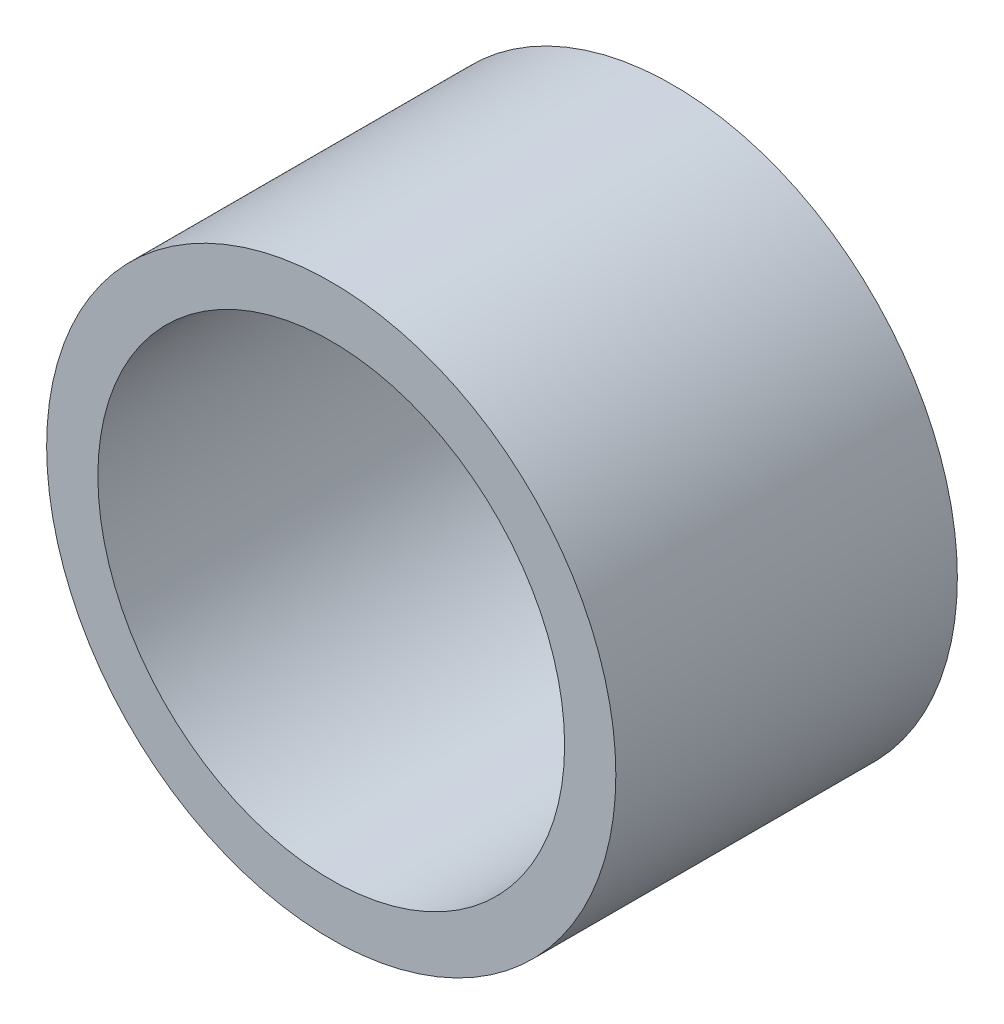
from build123d import *

# Parameters (mm, degrees)
SKETCH1_R           = 5
SKETCH1_R_2         = 4.1
BOSS_EXTRUDE1_DEPTH = 6


with BuildPart() as part:
    # Sketch1 → Boss-Extrude1 (new body)
    with BuildSketch(Plane.XY):
        Circle(SKETCH1_R)
        Circle(SKETCH1_R_2, mode=Mode.SUBTRACT)
    extrude(amount=BOSS_EXTRUDE1_DEPTH)


solid = part.part
